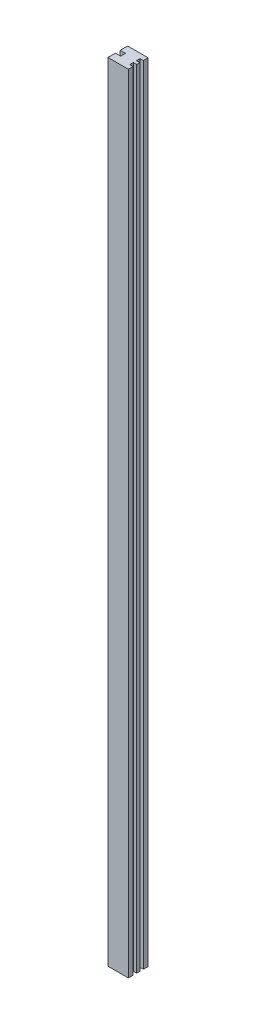
from build123d import *

# Parameters (mm, degrees)
EXTRUDE_1_DEPTH = 1200


with BuildPart() as part:
    # Эскиз1 → Бобышка-Вытянуть1 (new body)
    with BuildSketch(Plane(origin=(0, 0, 0), x_dir=(1, 0, 0), z_dir=(0, 1, 0))):
        Polygon((0, 3.657663655), (0, -3.657663655), (-7.956991175, -3.657663655), (-7.956991175, -15.100199162), (23.147610692, -15.100199162), (23.147610692, -7.866570821), (18.090813442, -7.866570821), (18.090813442, -2.372011956), (23.147610692, -2.372011956), (23.147610692, 2.372011956), (18.090813442, 2.372011956), (18.090813442, 7.866570821), (23.147610692, 7.866570821), (23.147610692, 15.100199162), (-7.956991175, 15.100199162), (-7.956991175, 3.657663655), align=None)
    extrude(amount=EXTRUDE_1_DEPTH)


solid = part.part
